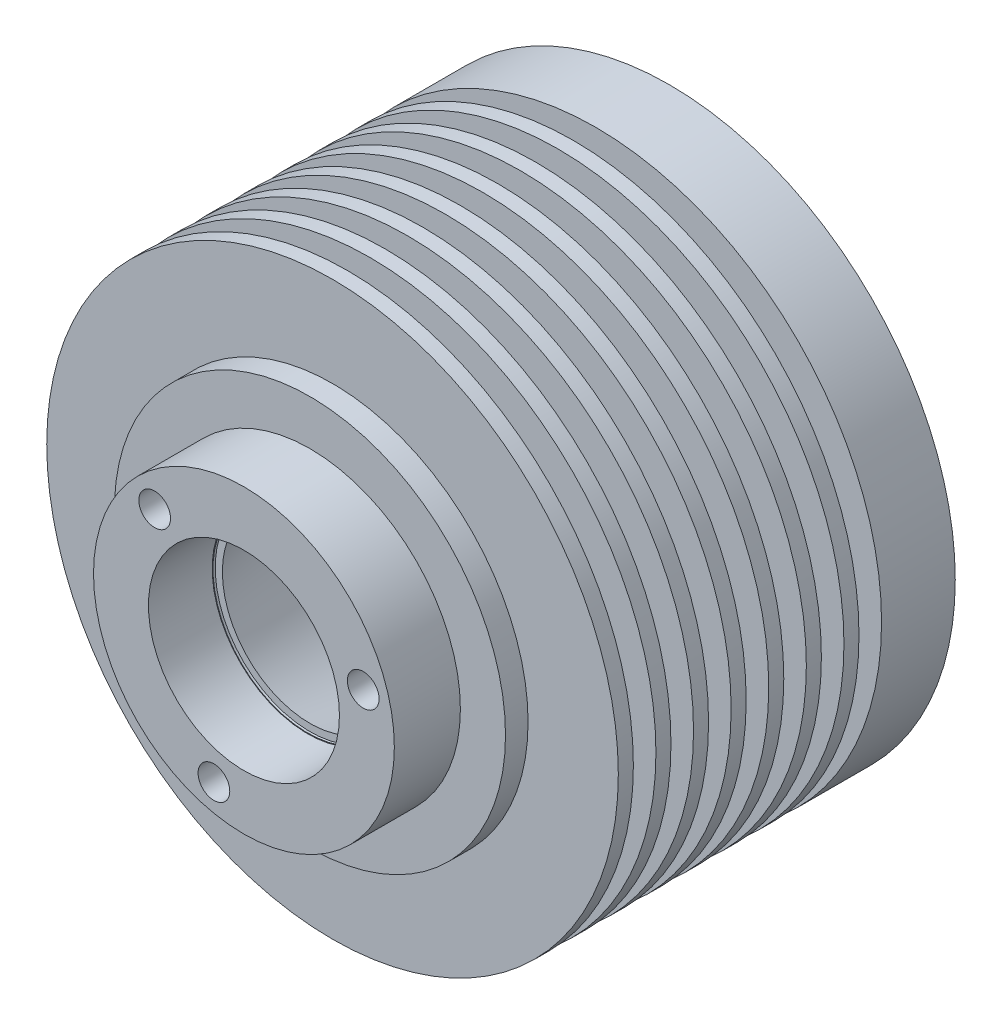
from build123d import *

# Parameters (mm, degrees)
ESQUISSE1_R         = 20
ESQUISSE1_R_2       = 12.7
BOSS_EXTRU_1_DEPTH  = 8.78
ESQUISSE2_R         = 38
ESQUISSE2_R_2       = 11.2
BOSS_EXTRU_2_DEPTH  = 47.8
CHANFREIN3_SIZE     = 11.200084029
CHANFREIN3_SIZE_2   = 49.8
SKETCH7_R           = 38
SKETCH7_R_2         = 26
CUT_EXTRUDE2_DEPTH  = 3
CIRPATTERN1_COUNT   = 3
CIRPATTERN2_COUNT   = 3
SKETCH23_R          = 13.7
SKETCH23_R_2        = 12.6
BOSS_EXTRUDE1_DEPTH = 0.3
LPATTERN1_COUNT     = 8
LPATTERN1_PITCH     = 5


with BuildPart() as part:
    # Esquisse1 → Boss.-Extru.1 (new body)
    with BuildSketch(Plane.XY):
        Circle(ESQUISSE1_R)
        Circle(ESQUISSE1_R_2, mode=Mode.SUBTRACT)
    extrude(amount=BOSS_EXTRU_1_DEPTH)

    # Esquisse2 → Boss.-Extru.2 (add)
    with BuildSketch(Plane(origin=(0, 0, 0), x_dir=(-1, 0, 0), z_dir=(0, 0, -1))):
        with Locations(Location((0, 0, 0), (0, 0, 180))):
            Circle(ESQUISSE2_R)
        with Locations(Location((0, 0, 0), (0, 0, 180))):
            Circle(ESQUISSE2_R_2, mode=Mode.SUBTRACT)
    extrude(amount=BOSS_EXTRU_2_DEPTH)

    # Chanfrein3
    # the kernel refuses this chamfer: 49.8, 11.200084029 mm, written as the material it takes off along each edge
    with BuildSketch(Plane(origin=(0, 0, -47.8), x_dir=(1, 0, 0), z_dir=(0, 1, 0))) as chanfrein3_piece_1:
        Polygon((11.2 + CHANFREIN3_SIZE, 0), (11.2, -CHANFREIN3_SIZE_2), (11.2, 0), align=None)
    revolve(axis=Axis((0, 0, -47.8), (0, 0, -1)), mode=Mode.SUBTRACT)

    # Sketch7 → Cut-Extrude2 (cut)
    with BuildSketch(Plane.XY):
        Circle(SKETCH7_R)
        Circle(SKETCH7_R_2, mode=Mode.SUBTRACT)
    cut_extrude2 = extrude(amount=-CUT_EXTRUDE2_DEPTH, mode=Mode.SUBTRACT)

    # Sketch19 → Hole for #4 300® SC Nuts (SP)2 (revolve, cut)
    with BuildSketch(Plane(origin=(28.837585054, 8.270047658, -47.8), x_dir=(0, 1, 0), z_dir=(1, 0, 0))):
        Polygon((0, 0), (0, 6.266734357), (2.1082, 5), (2.1082, 0), align=None)
    hole_for_4_300_sc_nuts_sp_2 = revolve(axis=Axis((28.837585054, 8.270047658, -54.15), (0, 0, 1)), mode=Mode.SUBTRACT)

    # CirPattern1: Hole for #4 300® SC Nuts (SP)2 ×3 about axis
    cirpattern1_axis = Axis((0, 0, 0), (0, 0, 1))
    for i in range(1, CIRPATTERN1_COUNT):
        add(hole_for_4_300_sc_nuts_sp_2.rotate(cirpattern1_axis, i * 360 / CIRPATTERN1_COUNT), mode=Mode.SUBTRACT)

    # Sketch22 → Hole for #4 300® SC Nuts (SP)3 (revolve, cut)
    with BuildSketch(Plane(origin=(15.86067178, 4.548526212, 8.78), x_dir=(0, -1, 0), z_dir=(1, 0, 0))):
        Polygon((0, 0), (0, 6.266734357), (2.1082, 5), (2.1082, 0), align=None)
    hole_for_4_300_sc_nuts_sp_3 = revolve(axis=Axis((15.86067178, 4.548526212, 15.13), (0, 0, -1)), mode=Mode.SUBTRACT)

    # CirPattern2: Hole for #4 300® SC Nuts (SP)3 ×3 about axis
    cirpattern2_axis = Axis((0, 0, 0), (0, 0, 1))
    for i in range(1, CIRPATTERN2_COUNT):
        add(hole_for_4_300_sc_nuts_sp_3.rotate(cirpattern2_axis, i * 360 / CIRPATTERN2_COUNT), mode=Mode.SUBTRACT)

    # Sketch23 → Boss-Extrude1 (add)
    with BuildSketch(Plane.XY):
        Circle(SKETCH23_R)
        Circle(SKETCH23_R_2, mode=Mode.SUBTRACT)
    extrude(amount=BOSS_EXTRUDE1_DEPTH)

    # LPattern1: Cut-Extrude2 ×8
    with Locations(*[(0, 0, -i * LPATTERN1_PITCH) for i in range(1, LPATTERN1_COUNT)]):
        add(cut_extrude2, mode=Mode.SUBTRACT)


solid = part.part
